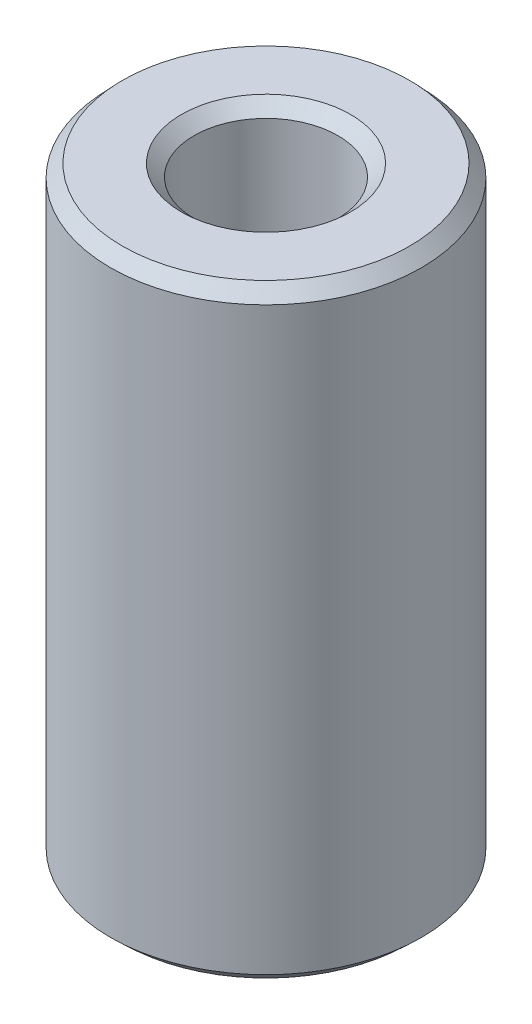
from build123d import *
from OCP.BRepFilletAPI import BRepFilletAPI_MakeChamfer

# Parameters (mm, degrees)
SKETCH1_R           = 15
BOSS_EXTRUDE1_DEPTH = 58.326497589
SKETCH2_R           = 6.929767799
CUT_EXTRUDE1_DEPTH  = 63.06432406
CHAMFER1_SIZE       = 1.228134379
CHAMFER1_SIZE2      = 1.150082685


with BuildPart() as part:
    # Sketch1 → Boss-Extrude1 (new body)
    with BuildSketch(Plane(origin=(0, 0, 0), x_dir=(1, 0, 0), z_dir=(0, 1, 0))):
        Circle(SKETCH1_R)
    extrude(amount=BOSS_EXTRUDE1_DEPTH)

    # Sketch2 → Cut-Extrude1 (cut, through all)
    with BuildSketch(Plane(origin=(0, 0, 0), x_dir=(1, 0, 0), z_dir=(0, 1, 0))):
        Circle(SKETCH2_R)
    extrude(amount=CUT_EXTRUDE1_DEPTH, mode=Mode.SUBTRACT)

    # Chamfer1: one chamfer whose edges measure the first distance from different faces: ONE call of the kernel's chamfer builder (chamfer() names one face for all edges)
    chamfer1_edges_1 = [part.edges().sort_by_distance(p)[0] for p in [
        (-6.929767799, 58.326497589, 0),
    ]]
    chamfer1_side_1 = [part.faces().sort_by_distance(p)[0] for p in [
        (-14.575735931, 58.326497589, 0),
    ]]
    chamfer1_edges_2 = [part.edges().sort_by_distance(p)[0] for p in [
        (-6.929767799, 0, 0),
    ]]
    chamfer1_side_2 = [part.faces().sort_by_distance(p)[0] for p in [
        (-6.929767799, 29.163248794, 0),
    ]]
    chamfer1_edges_3 = [part.edges().sort_by_distance(p)[0] for p in [
        (-15, 0, 0),
    ]]
    chamfer1_side_3 = [part.faces().sort_by_distance(p)[0] for p in [
        (-14.575735931, 0, 0),
    ]]
    chamfer1_edges_4 = [part.edges().sort_by_distance(p)[0] for p in [
        (-15, 58.326497589, 0),
    ]]
    chamfer1_side_4 = [part.faces().sort_by_distance(p)[0] for p in [
        (-15, 29.163248794, 0),
    ]]
    chamfer1 = BRepFilletAPI_MakeChamfer(part.part.solid().wrapped)
    for e in chamfer1_edges_1:
        chamfer1.Add(CHAMFER1_SIZE, CHAMFER1_SIZE2, e.wrapped, chamfer1_side_1[0].wrapped)  # the first distance lies on this face
    for e in chamfer1_edges_2:
        chamfer1.Add(CHAMFER1_SIZE, CHAMFER1_SIZE2, e.wrapped, chamfer1_side_2[0].wrapped)  # the first distance lies on this face
    for e in chamfer1_edges_3:
        chamfer1.Add(CHAMFER1_SIZE, CHAMFER1_SIZE2, e.wrapped, chamfer1_side_3[0].wrapped)  # the first distance lies on this face
    for e in chamfer1_edges_4:
        chamfer1.Add(CHAMFER1_SIZE, CHAMFER1_SIZE2, e.wrapped, chamfer1_side_4[0].wrapped)  # the first distance lies on this face
    add(Compound.cast(chamfer1.Shape()), mode=Mode.REPLACE)


solid = part.part
